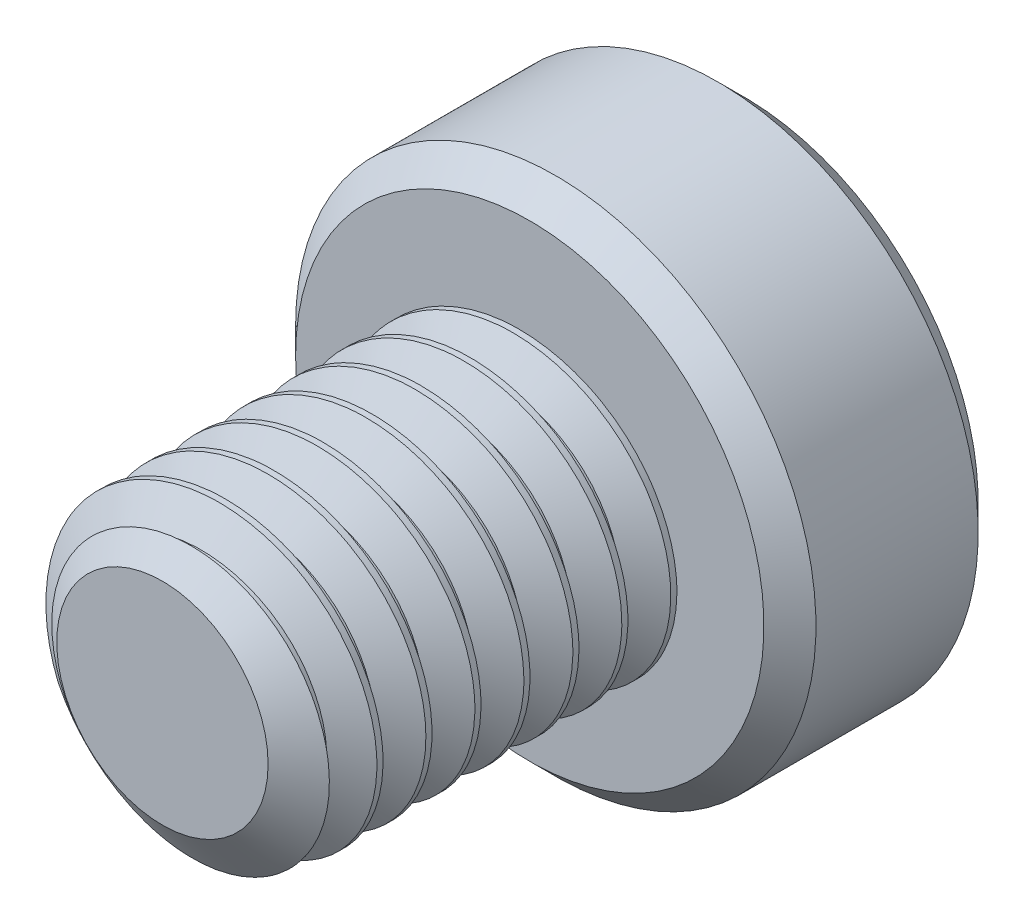
from build123d import *

# Parameters (mm, degrees)
SKETCH1_R          = 2.5
EXTRUDE1_DEPTH     = 6
CUT_SWEEP1_PITCH   = 0.8
SKETCH6_R          = 4.25
EXTRUDE2_DEPTH     = 3.5
CUT_EXTRUDE1_DEPTH = 2.25
CHAMFER1_SIZE      = 0.425


with BuildPart() as part:
    # Sketch1 → Extrude1 (new body)
    with BuildSketch(Plane.XY):
        Circle(SKETCH1_R)
    extrude(amount=-EXTRUDE1_DEPTH)

    # Cut-Sweep1: the profile of Sketch3 profile screwed along a right-hand helix of 8.5 turns, 6 arcs to a turn; built about Z, then put on its axis
    cut_sweep1_z = Axis((0, 0, 0), (0, 0, 1))
    cut_sweep1_corners = [(2.5003, 0, -0.700173205), (1.980384758, 0, -0.4), (1.980384758, 0, -0.3), (2.5003, 0, 0.000173205)]
    with BuildLine(mode=Mode.PRIVATE) as cut_sweep1_profile:
        Line(cut_sweep1_corners[0], cut_sweep1_corners[1])
        Line(cut_sweep1_corners[1], cut_sweep1_corners[2])
        Line(cut_sweep1_corners[2], cut_sweep1_corners[3])
        Line(cut_sweep1_corners[3], cut_sweep1_corners[0])
    cut_sweep1_cap = Face(cut_sweep1_profile.wire())
    cut_sweep1_turn_angles = [0, 30, 60, 90, 120, 150, 180, 210, 240, 270, 300, 330, 360]
    cut_sweep1_turn_weights = [1, 0.8660254037844387, 1, 0.8660254037844387, 1, 0.8660254037844387, 1, 0.8660254037844387, 1, 0.8660254037844387, 1, 0.8660254037844387, 1]
    cut_sweep1_turn_rails = [Edge.make_bspline([Vector(p[0], p[1], 0).rotate(cut_sweep1_z, cut_sweep1_turn_angles[k]) / cut_sweep1_turn_weights[k] + Vector(0, 0, p[2] + CUT_SWEEP1_PITCH * cut_sweep1_turn_angles[k] / 360) for k in range(13)], [0, 0, 0, 1, 1, 2, 2, 3, 3, 4, 4, 5, 5, 6, 6, 6], 2, cut_sweep1_turn_weights) for p in cut_sweep1_corners]
    cut_sweep1_turn_sides = [Face.make_surface_from_curves(cut_sweep1_turn_rails[p[0]], cut_sweep1_turn_rails[p[1]]) for p in [(0, 1), (1, 2), (2, 3), (3, 0)]]
    cut_sweep1_last_angles = [2880, 2910, 2940, 2970, 3000, 3030, 3060]
    cut_sweep1_last_weights = [1, 0.8660254037844387, 1, 0.8660254037844387, 1, 0.8660254037844287, 1]
    cut_sweep1_last_rails = [Edge.make_bspline([Vector(p[0], p[1], 0).rotate(cut_sweep1_z, cut_sweep1_last_angles[k]) / cut_sweep1_last_weights[k] + Vector(0, 0, p[2] + CUT_SWEEP1_PITCH * cut_sweep1_last_angles[k] / 360) for k in range(7)], [0, 0, 0, 1, 1, 2, 2, 3, 3, 3], 2, cut_sweep1_last_weights) for p in cut_sweep1_corners]
    cut_sweep1_last_sides = [Face.make_surface_from_curves(cut_sweep1_last_rails[p[0]], cut_sweep1_last_rails[p[1]]) for p in [(0, 1), (1, 2), (2, 3), (3, 0)]]
    cut_sweep1 = Plane(origin=(0, 0, 0), x_dir=(0, 1, 0), z_dir=(0, 0, -1)) * Solid(Shell([*[p.moved(Location((0, 0, CUT_SWEEP1_PITCH * i))) for i in range(8) for p in cut_sweep1_turn_sides], *cut_sweep1_last_sides, cut_sweep1_cap, cut_sweep1_cap.rotate(cut_sweep1_z, 3060).moved(Location((0, 0, CUT_SWEEP1_PITCH * 3060 / 360)))]))
    add(cut_sweep1, mode=Mode.SUBTRACT)

    # Sketch4 → Cut-Revolve1 (revolve, cut)
    with BuildSketch(Plane(origin=(0, 0, 0), x_dir=(0, 0, -1), z_dir=(1, 0, 0)), mode=Mode.PRIVATE) as cut_revolve1_sk:
        Polygon((0.541691224, 2.5), (0, 1.726384758), (0, 2.5), align=None)
    revolve(cut_revolve1_sk.sketch.rotate(Axis((0, 0, 0), (0, 0, -1)), 260.43858876), axis=Axis((0, 0, 0), (0, 0, -1)), mode=Mode.SUBTRACT)

    # Sketch6 → Extrude2 (add)
    with BuildSketch(Plane(origin=(0, 0, -6), x_dir=(-1, 0, 0), z_dir=(0, 0, -1))):
        Circle(SKETCH6_R)
    extrude(amount=EXTRUDE2_DEPTH)

    # Sketch7 → Cut-Extrude1 (cut)
    with BuildSketch(Plane(origin=(0, 0, -9.5), x_dir=(-1, 0, 0), z_dir=(0, 0, -1))):
        Polygon((0, 1.732050808), (-1.5, 0.866025404), (-1.5, -0.866025404), (0, -1.732050808), (1.5, -0.866025404), (1.5, 0.866025404), align=None)
    extrude(amount=-CUT_EXTRUDE1_DEPTH, mode=Mode.SUBTRACT)

    # Cut-Extrude2 cone 1 section (through the dimple's axis) → Cut-Extrude2 (revolve, cut)
    with BuildSketch(Plane(origin=(0, 0, -9.5), x_dir=(0, 1, 0), z_dir=(1, 0, 0))):
        Polygon((0, 0), (1.732050808, 0), (0, 1.732050808), align=None)
    revolve(axis=Axis((0, 0, -9.5), (0, 0, 1)), mode=Mode.SUBTRACT)

    # Chamfer1
    chamfer1_edges = [part.edges().sort_by_distance(p)[0] for p in [
        (4.25, 0, -6),
        (4.25, 0, -9.5),
    ]]
    chamfer(chamfer1_edges, length=CHAMFER1_SIZE)


solid = part.part
